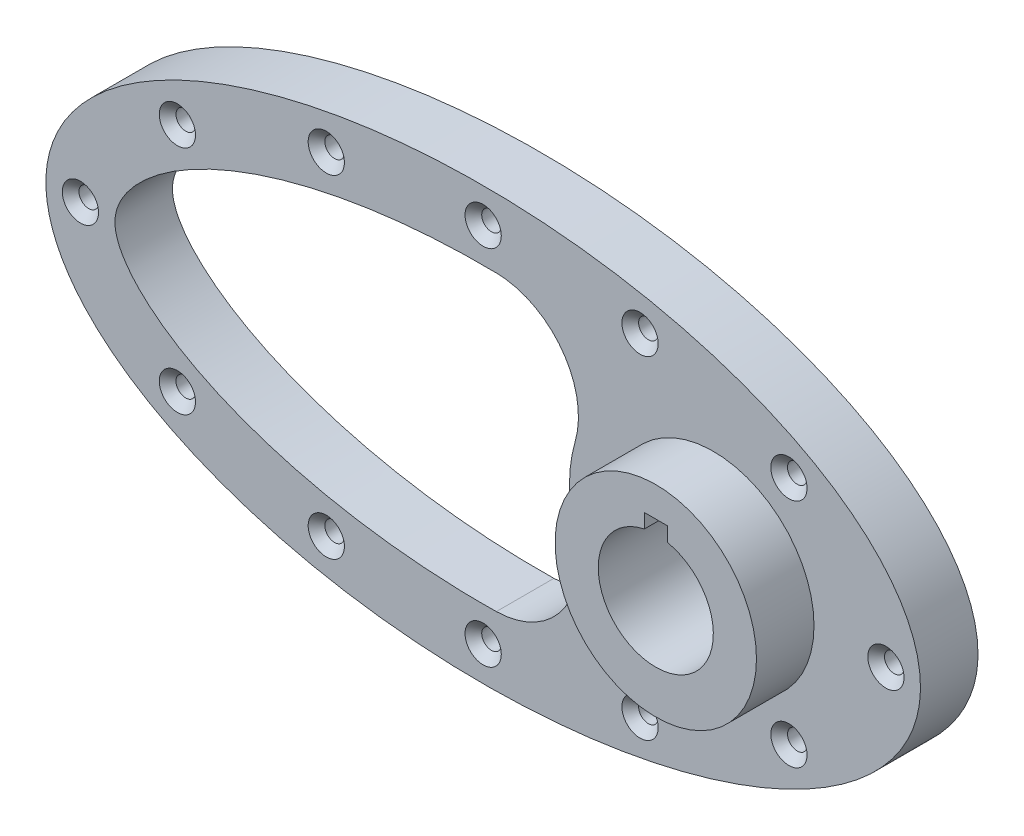
from build123d import *

# Parameters (mm, degrees)
SKETCH1_RX                                      = 76
SKETCH1_RY                                      = 37.5
EXTRUDE1_DEPTH                                  = 10
SKETCH2_R                                       = 17.5
EXTRUDE2_DEPTH                                  = 10
EXTRUDE3_DEPTH                                  = 86.336100216
EXTRUDE4_DEPTH                                  = 88.076116282
CSK_FOR_M3_FLAT_HEAD_MACHINE_SCREW1_D           = 3.4
CSK_FOR_M3_FLAT_HEAD_MACHINE_SCREW1_CSINK_D     = 6.3
CSK_FOR_M3_FLAT_HEAD_MACHINE_SCREW1_CSINK_ANGLE = 90


# Read off the part's stored shape, not the designer's step: CrvPattern1
with BuildPart() as part:
    # Sketch1 → Extrude1 (new body)
    with BuildSketch(Plane.XY):
        with Locations((0, 0)):
            Ellipse(SKETCH1_RX, SKETCH1_RY)
    extrude(amount=EXTRUDE1_DEPTH)

    # Sketch2 → Extrude2 (add)
    with BuildSketch(Plane.XY.offset(10)):
        with Locations((40, 0)):
            Circle(SKETCH2_R)
    extrude(amount=EXTRUDE2_DEPTH)

    # Sketch3 → Extrude3 (cut, through all)
    with BuildSketch(Plane.XY.offset(10)):
        with BuildLine():
            ThreePointArc((15.98592019, 6.951544496), (15, 3.7e-08), (15.98592017, -6.951544426))
            ThreePointArc((15.98592017, -6.951544426), (13.718784315, -19.601466006), (2.291407331, -25.481557521))
            add(Edge.make_bspline(
                [(2.29138759, 25.481557951), (1.536487696, 25.493722982), (0.781887509, 25.499850821), (-2.981033191, 25.500581652), (-5.984925899, 25.40599226), (-11.983100173, 25.023209453), (-14.977386018, 24.73510222), (-20.95563043, 23.950858112), (-23.939601905, 23.454981247), (-28.406683292, 22.532373907), (-29.89678094, 22.194215189), (-32.857840607, 21.45580248), (-34.328995491, 21.055659759), (-37.25072809, 20.187471783), (-38.70131721, 19.719464163), (-41.57930104, 18.706909763), (-43.008786731, 18.161435894), (-45.820852611, 16.989909653), (-47.205317632, 16.36342386), (-49.923326001, 15.014306389), (-51.256986979, 14.291896812), (-53.860708588, 12.726993001), (-55.131807019, 11.884621283), (-57.583878718, 10.037173385), (-58.749677002, 9.04538051), (-60.362588222, 7.404251705), (-60.876365057, 6.831585201), (-61.825648091, 5.638947207), (-62.26365963, 5.017320455), (-62.842802577, 4.031076714), (-63.022734978, 3.693267438), (-63.349140243, 2.994531599), (-63.494672168, 2.634866816), (-63.735502964, 1.90638021), (-63.831747251, 1.535622764), (-63.964260682, 0.7779445), (-64, 0.389318673), (-64, 0), (-64, -0.778637345), (-63.859069102, -1.530171415), (-63.497163716, -2.628527212), (-63.351411012, -2.989020671), (-63.027073259, -3.684617278), (-62.847612543, -4.022381244), (-62.267637767, -5.011537226), (-61.824495344, -5.641036298), (-60.865057448, -6.845142379), (-60.353939893, -7.413375257), (-58.75112499, -9.043254515), (-57.59094473, -10.031136374), (-55.758025791, -11.413165279), (-55.130622026, -11.856962148), (-53.861474171, -12.706272639), (-53.218031918, -13.113090985), (-51.264821291, -14.287519606), (-49.932355056, -15.009477583), (-47.219389061, -16.356783508), (-45.83877221, -16.981895954), (-43.036850002, -18.150283887), (-41.615494943, -18.693459408), (-38.73690368, -19.707642558), (-37.289143264, -20.175264836), (-32.930023695, -21.47290858), (-29.999989675, -22.199648454), (-24.100467658, -23.425248805), (-21.130888818, -23.923584596), (-15.156309454, -24.715666618), (-12.151276192, -25.009223767), (-7.618397002, -25.30326182), (-6.103199372, -25.376797121), (-3.064360152, -25.475096866), (-1.546314468, -25.499657235), (0.743333331, -25.500170046), (1.517739245, -25.494026052), (2.291407331, -25.481557521)],
                knots=[0.74216518, 0.74216518, 0.74216518, 0.74216518, 0.75, 0.75, 0.78125, 0.78125, 0.8125, 0.8125, 0.84375, 0.84375, 0.859375, 0.859375, 0.875, 0.875, 0.890625, 0.890625, 0.90625, 0.90625, 0.921875, 0.921875, 0.9375, 0.9375, 0.953125, 0.953125, 0.96875, 0.96875, 0.9765625, 0.9765625, 0.984375, 0.984375, 0.98828125, 0.98828125, 0.9921875, 0.9921875, 0.99609375, 0.99609375, 1, 1, 1, 1.0078125, 1.0078125, 1.01171875, 1.01171875, 1.015625, 1.015625, 1.0234375, 1.0234375, 1.03125, 1.03125, 1.046875, 1.046875, 1.0546875, 1.0546875, 1.0625, 1.0625, 1.078125, 1.078125, 1.09375, 1.09375, 1.109375, 1.109375, 1.125, 1.125, 1.15625, 1.15625, 1.1875, 1.1875, 1.21875, 1.21875, 1.234375, 1.234375, 1.25, 1.25, 1.257997075, 1.257997075, 1.257997075, 1.257997075], degree=3))
            ThreePointArc((2.29138759, 25.481557951), (13.718778483, 19.601474052), (15.98592019, 6.951544496))
        make_face()
    extrude(amount=-EXTRUDE3_DEPTH, mode=Mode.SUBTRACT)

    # Sketch4 → Extrude4 (cut, through all)
    with BuildSketch(Plane.XY.offset(20)):
        with BuildLine():
            Line((38, 9.797958971), (38, 12.297958971))
            Line((38, 12.297958971), (42, 12.297958971))
            Line((42, 12.297958971), (42, 9.797958971))
            ThreePointArc((42, 9.797958971), (40, -10), (38, 9.797958971))
        make_face()
    extrude(amount=-EXTRUDE4_DEPTH, mode=Mode.SUBTRACT)

    # CSK for M3 Flat Head Machine Screw1 (through all)
    with Locations(Plane.XY.offset(10)):
        with Locations((-70, 0)):
            CounterSinkHole(CSK_FOR_M3_FLAT_HEAD_MACHINE_SCREW1_D / 2, CSK_FOR_M3_FLAT_HEAD_MACHINE_SCREW1_CSINK_D / 2, counter_sink_angle=CSK_FOR_M3_FLAT_HEAD_MACHINE_SCREW1_CSINK_ANGLE)

    # CrvPattern1 outline → CrvPattern1 (revolve, cut)
    with BuildSketch(Plane(origin=(-53.141830984, -20.07698957, 0), x_dir=(1, 0, 0), z_dir=(0, -1, 0))):
        Polygon((0, 0), (1.7, 0), (1.7, 8.55), (3.15, 10), (0, 10), align=None)
    revolve(axis=Axis((-53.141830984, -20.07698957, 0), (0, 0, 1)), mode=Mode.SUBTRACT)

    # CrvPattern1 2 outline → CrvPattern1 2 (revolve, cut)
    with BuildSketch(Plane(origin=(-27.265149877, -28.891712225, 0), x_dir=(1, 0, 0), z_dir=(0, -1, 0))):
        Polygon((0, 0), (1.7, 0), (1.7, 8.55), (3.15, 10), (0, 10), align=None)
    revolve(axis=Axis((-27.265149877, -28.891712225, 0), (0, 0, 1)), mode=Mode.SUBTRACT)

    # CrvPattern1 3 outline → CrvPattern1 3 (revolve, cut)
    with BuildSketch(Plane(origin=(-0.000662841, -31.49999966, 0), x_dir=(1, 0, 0), z_dir=(0, -1, 0))):
        Polygon((0, 0), (1.7, 0), (1.7, 8.55), (3.15, 10), (0, 10), align=None)
    revolve(axis=Axis((-0.000662841, -31.49999966, 0), (0, 0, 1)), mode=Mode.SUBTRACT)

    # CrvPattern1 4 outline → CrvPattern1 4 (revolve, cut)
    with BuildSketch(Plane(origin=(27.26548431, -28.891613547, 0), x_dir=(1, 0, 0), z_dir=(0, -1, 0))):
        Polygon((0, 0), (1.7, 0), (1.7, 8.55), (3.15, 10), (0, 10), align=None)
    revolve(axis=Axis((27.26548431, -28.891613547, 0), (0, 0, 1)), mode=Mode.SUBTRACT)

    # CrvPattern1 5 outline → CrvPattern1 5 (revolve, cut)
    with BuildSketch(Plane(origin=(53.142300477, -20.076697483, 0), x_dir=(1, 0, 0), z_dir=(0, -1, 0))):
        Polygon((0, 0), (1.7, 0), (1.7, 8.55), (3.15, 10), (0, 10), align=None)
    revolve(axis=Axis((53.142300477, -20.076697483, 0), (0, 0, 1)), mode=Mode.SUBTRACT)

    # CrvPattern1 6 outline → CrvPattern1 6 (revolve, cut)
    with BuildSketch(Plane(origin=(69.999999136, 1.6117e-05, 0), x_dir=(1, 0, 0), z_dir=(0, -1, 0))):
        Polygon((0, 0), (1.7, 0), (1.7, 8.55), (3.15, 10), (0, 10), align=None)
    revolve(axis=Axis((69.999999136, 1.6117e-05, 0), (0, 0, 1)), mode=Mode.SUBTRACT)

    # CrvPattern1 7 outline → CrvPattern1 7 (revolve, cut)
    with BuildSketch(Plane(origin=(53.141166185, 20.07735132, 0), x_dir=(1, 0, 0), z_dir=(0, -1, 0))):
        Polygon((0, 0), (1.7, 0), (1.7, 8.55), (3.15, 10), (0, 10), align=None)
    revolve(axis=Axis((53.141166185, 20.07735132, 0), (0, 0, 1)), mode=Mode.SUBTRACT)

    # CrvPattern1 8 outline → CrvPattern1 8 (revolve, cut)
    with BuildSketch(Plane(origin=(27.265630656, 28.891648613, 0), x_dir=(1, 0, 0), z_dir=(0, -1, 0))):
        Polygon((0, 0), (1.7, 0), (1.7, 8.55), (3.15, 10), (0, 10), align=None)
    revolve(axis=Axis((27.265630656, 28.891648613, 0), (0, 0, 1)), mode=Mode.SUBTRACT)

    # CrvPattern1 9 outline → CrvPattern1 9 (revolve, cut)
    with BuildSketch(Plane(origin=(-7.3558e-05, 31.50000088, 0), x_dir=(1, 0, 0), z_dir=(0, -1, 0))):
        Polygon((0, 0), (1.7, 0), (1.7, 8.55), (3.15, 10), (0, 10), align=None)
    revolve(axis=Axis((-7.3558e-05, 31.50000088, 0), (0, 0, 1)), mode=Mode.SUBTRACT)

    # CrvPattern1 10 outline → CrvPattern1 10 (revolve, cut)
    with BuildSketch(Plane(origin=(-27.26562412, 28.891596465, 0), x_dir=(1, 0, 0), z_dir=(0, -1, 0))):
        Polygon((0, 0), (1.7, 0), (1.7, 8.55), (3.15, 10), (0, 10), align=None)
    revolve(axis=Axis((-27.26562412, 28.891596465, 0), (0, 0, 1)), mode=Mode.SUBTRACT)

    # CrvPattern1 11 outline → CrvPattern1 11 (revolve, cut)
    with BuildSketch(Plane(origin=(-53.141389818, 20.077226862, 0), x_dir=(1, 0, 0), z_dir=(0, -1, 0))):
        Polygon((0, 0), (1.7, 0), (1.7, 8.55), (3.15, 10), (0, 10), align=None)
    revolve(axis=Axis((-53.141389818, 20.077226862, 0), (0, 0, 1)), mode=Mode.SUBTRACT)


solid = part.part
